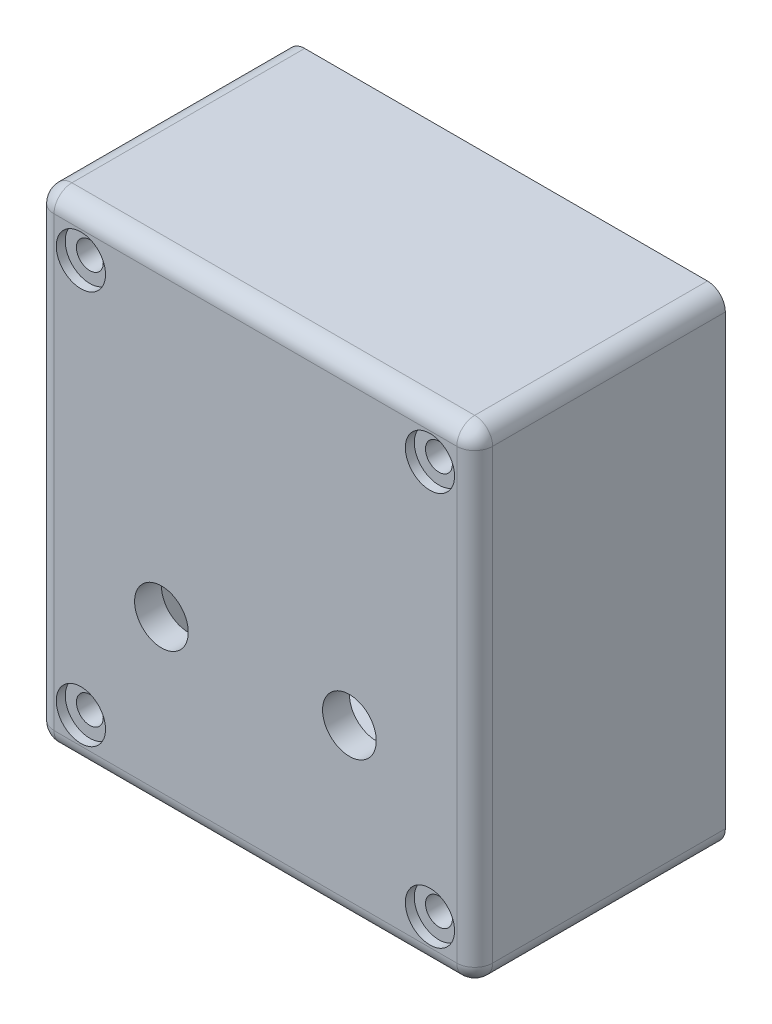
from build123d import *

# Parameters (mm, degrees)
EXTRUDE_1_DEPTH     = 3
EXTRUDE_START       = -25
EXTRUDE_2_DEPTH     = 25
SKETCH_3_R          = 1.5
CUT_EXTRUDE_1_DEPTH = 45.206899914
SKETCH_4_R          = 2.75
CUT_EXTRUDE_2_DEPTH = 1
SKETCH_5_W          = 33
SKETCH_5_H          = 6
CUT_EXTRUDE_3_DEPTH = 1.5
SKETCH_6_W          = 5
SKETCH_6_H          = 3
CUT_EXTRUDE_4_DEPTH = 63.683729946
FILLET_1_R          = 2
SKETCH_7_R          = 3
CUT_EXTRUDE_5_DEPTH = 45.206899914


with BuildPart() as part:
    # 草图1 → 凸台-拉伸1 (new body)
    with BuildSketch(Plane.XY):
        with BuildLine():
            Line((-22.5, -27), (22.5, -27))
            ThreePointArc((22.5, -27), (23.914213562, -26.414213562), (24.5, -25))
            Line((24.5, -25), (24.5, 25))
            ThreePointArc((24.5, 25), (23.914213562, 26.414213562), (22.5, 27))
            Line((22.5, 27), (-22.5, 27))
            ThreePointArc((-22.5, 27), (-23.914213562, 26.414213562), (-24.5, 25))
            Line((-24.5, 25), (-24.5, -25))
            ThreePointArc((-24.5, -25), (-23.914213562, -26.414213562), (-22.5, -27))
        make_face()
    extrude(amount=EXTRUDE_1_DEPTH)

    # 草图1<3> → 凸台-拉伸2 (add)
    with BuildSketch(Plane.XY.offset(EXTRUDE_START)):
        with BuildLine():
            Line((-22.5, -27), (22.5, -27))
            ThreePointArc((22.5, -27), (23.914213562, -26.414213562), (24.5, -25))
            Line((24.5, -25), (24.5, 25))
            ThreePointArc((24.5, 25), (23.914213562, 26.414213562), (22.5, 27))
            Line((22.5, 27), (-22.5, 27))
            ThreePointArc((-22.5, 27), (-23.914213562, 26.414213562), (-24.5, 25))
            Line((-24.5, 25), (-24.5, -25))
            ThreePointArc((-24.5, -25), (-23.914213562, -26.414213562), (-22.5, -27))
        make_face()
        with BuildLine():
            Line((-20.5, -25), (20.5, -25))
            ThreePointArc((20.5, -25), (21.914213562, -24.414213562), (22.5, -23))
            Line((22.5, -23), (22.5, 23))
            ThreePointArc((22.5, 23), (21.914213562, 24.414213562), (20.5, 25))
            Line((20.5, 25), (-20.5, 25))
            ThreePointArc((-20.5, 25), (-21.914213562, 24.414213562), (-22.5, 23))
            Line((-22.5, 23), (-22.5, -23))
            ThreePointArc((-22.5, -23), (-21.914213562, -24.414213562), (-20.5, -25))
        make_face(mode=Mode.SUBTRACT)
    extrude(amount=EXTRUDE_2_DEPTH)

    # 草图3 → 切除-拉伸1 (cut, through all)
    with BuildSketch(Plane(origin=(0, 0, 0), x_dir=(-1, 0, 0), z_dir=(0, 0, -1))):
        with Locations((19.5, 22)):
            Circle(SKETCH_3_R)
        with Locations((19.5, -22)):
            Circle(SKETCH_3_R)
        with Locations((-19.5, -22)):
            Circle(SKETCH_3_R)
        with Locations((-19.5, 22)):
            Circle(SKETCH_3_R)
    extrude(amount=-CUT_EXTRUDE_1_DEPTH, mode=Mode.SUBTRACT)

    # 草图4 → 切除-拉伸2 (cut)
    with BuildSketch(Plane.XY.offset(3)):
        with Locations((-19.5, 22)):
            Circle(SKETCH_4_R)
        with Locations((19.5, 22)):
            Circle(SKETCH_4_R)
        with Locations((19.5, -22)):
            Circle(SKETCH_4_R)
        with Locations((-19.5, -22)):
            Circle(SKETCH_4_R)
    extrude(amount=-CUT_EXTRUDE_2_DEPTH, mode=Mode.SUBTRACT)

    # 草图5 → 切除-拉伸3 (cut)
    with BuildSketch(Plane(origin=(0, 0, 0), x_dir=(-1, 0, 0), z_dir=(0, 0, -1))):
        with Locations((0, 20)):
            Rectangle(SKETCH_5_W, SKETCH_5_H)
    extrude(amount=-CUT_EXTRUDE_3_DEPTH, mode=Mode.SUBTRACT)

    # 草图6 → 切除-拉伸4 (cut, through all)
    with BuildSketch(Plane(origin=(0, -25, 0), x_dir=(1, 0, 0), z_dir=(0, 1, 0))):
        with BuildLine():
            Line((2.5, 7.5), (-5.5, 7.5))
            ThreePointArc((-5.5, 7.5), (-6.207106781, 7.792893219), (-6.5, 8.5))
            Line((-6.5, 8.5), (-6.5, 10.5))
            ThreePointArc((-6.5, 10.5), (-6.207106781, 11.207106781), (-5.5, 11.5))
            Line((-5.5, 11.5), (2.5, 11.5))
            ThreePointArc((2.5, 11.5), (3.207106781, 11.207106781), (3.5, 10.5))
            Line((3.5, 10.5), (3.5, 8.5))
            ThreePointArc((3.5, 8.5), (3.207106781, 7.792893219), (2.5, 7.5))
        make_face()
        with Locations((9.5, 10.5)):
            Rectangle(SKETCH_6_W, SKETCH_6_H)
    extrude(amount=-CUT_EXTRUDE_4_DEPTH, mode=Mode.SUBTRACT)

    # 圆角1
    fillet_1_edges = [part.edges().sort_by_distance(p)[0] for p in [
        (-23.914213562, 26.414213562, 3),
        (-24.5, 0, 3),
        (-23.914213562, -26.414213562, 3),
        (0, -27, 3),
        (23.914213562, -26.414213562, 3),
        (24.5, 0, 3),
        (23.914213562, 26.414213562, 3),
        (0, 27, 3),
    ]]
    fillet(fillet_1_edges, radius=FILLET_1_R)

    # 草图7 → 切除-拉伸5 (cut, through all)
    with BuildSketch(Plane(origin=(0, 0, 0), x_dir=(-1, 0, 0), z_dir=(0, 0, -1))):
        with Locations((-10.5, -8)):
            Circle(SKETCH_7_R)
        with Locations((10.5, -8)):
            Circle(SKETCH_7_R)
    extrude(amount=-CUT_EXTRUDE_5_DEPTH, mode=Mode.SUBTRACT)


solid = part.part
